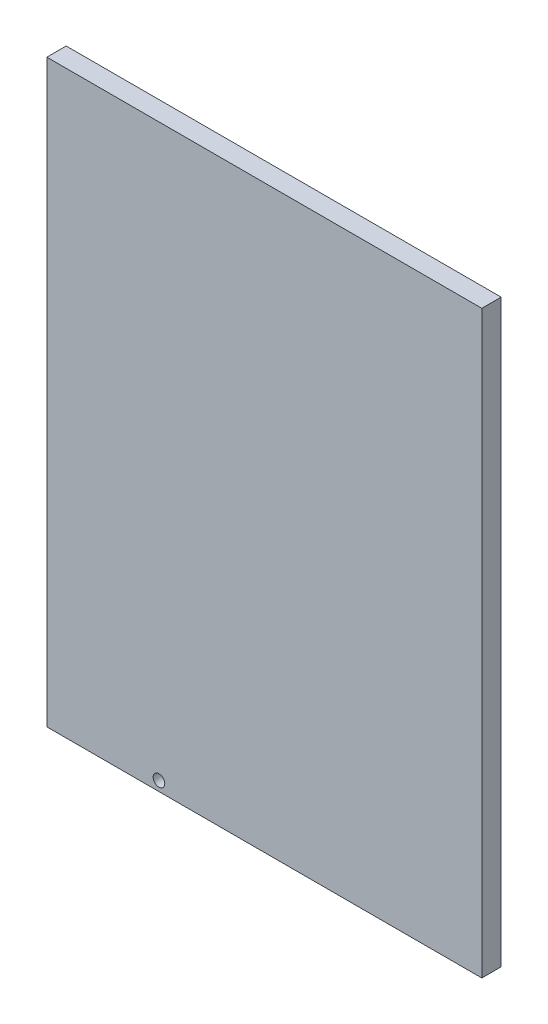
from build123d import *

# Parameters (mm, degrees)
SKETCH1_W           = 225
SKETCH1_H           = 300
BOSS_EXTRUDE1_DEPTH = 10
SKETCH2_R           = 3
CUT_EXTRUDE4_DEPTH  = 188.766477306


with BuildPart() as part:
    # Sketch1 → Boss-Extrude1 (new body)
    with BuildSketch(Plane.XY):
        Rectangle(SKETCH1_W, SKETCH1_H)
    extrude(amount=BOSS_EXTRUDE1_DEPTH)

    # Sketch2 → Cut-Extrude4 (cut, through all)
    with BuildSketch(Plane.XY.offset(10)):
        with Locations((-54.5, -145)):
            Circle(SKETCH2_R)
    extrude(amount=-CUT_EXTRUDE4_DEPTH, mode=Mode.SUBTRACT)


solid = part.part
